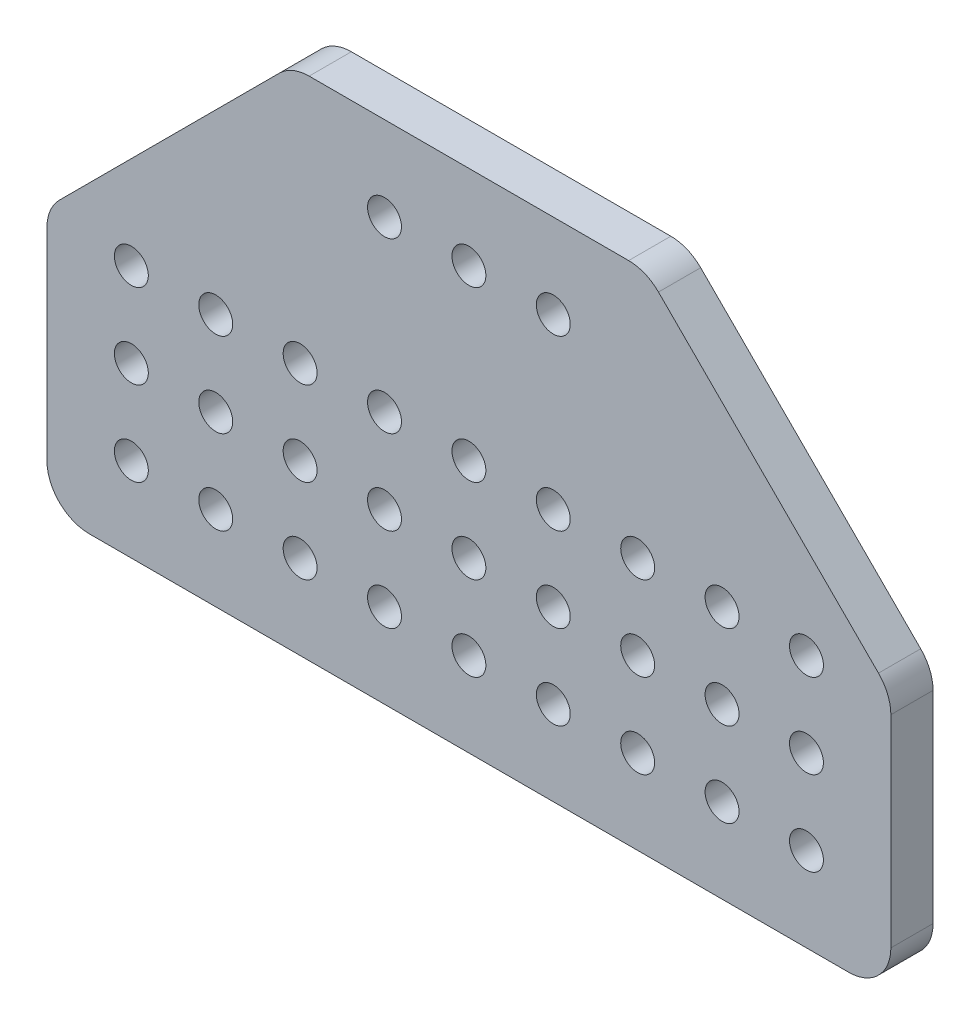
from build123d import *

# Parameters (mm, degrees)
SKETCH1_W               = 127
SKETCH1_H               = 82.55
BOSS_EXTRUDE1_DEPTH     = 6.35
CUT_EXTRUDE1_DEPTH      = 152.604172106
CUT_EXTRUDE1_DEPTH_BACK = 152.604172106
SKETCH2_R               = 2.5527
SKETCH3_R               = 2.5527
CUT_EXTRUDE2_DEPTH      = 152.604172106
CUT_EXTRUDE3_DEPTH      = 152.604172106
CUT_EXTRUDE4_DEPTH      = 152.604172106
FILLET1_R               = 6.35


with BuildPart() as part:
    # Sketch1 → Boss-Extrude1 (new body)
    with BuildSketch(Plane.XY):
        with Locations((63.5, 41.275)):
            Rectangle(SKETCH1_W, SKETCH1_H)
    extrude(amount=BOSS_EXTRUDE1_DEPTH)

    # Sketch2 → Cut-Extrude1 (cut, two sides: drawn at the far end of the back side and taken through both)
    with BuildSketch(Plane(origin=(0, 0, 0), x_dir=(-1, 0, 0), z_dir=(0, 0, -1)).offset(-CUT_EXTRUDE1_DEPTH_BACK)):
        with Locations((-76.2, 63.5)):
            Circle(SKETCH2_R)
        with Locations((-63.5, 63.5)):
            Circle(SKETCH2_R)
        with Locations((-50.8, 63.5)):
            Circle(SKETCH2_R)
    extrude(amount=CUT_EXTRUDE1_DEPTH + CUT_EXTRUDE1_DEPTH_BACK, mode=Mode.SUBTRACT)

    # Sketch3 → Cut-Extrude2 (cut, through all)
    with BuildSketch(Plane(origin=(0, 0, 0), x_dir=(-1, 0, 0), z_dir=(0, 0, -1))):
        with Locations((-114.3, 38.1)):
            Circle(SKETCH3_R)
        with Locations((-114.3, 25.4)):
            Circle(SKETCH3_R)
        with Locations((-114.3, 12.7)):
            Circle(SKETCH3_R)
        with Locations((-101.6, 38.1)):
            Circle(SKETCH3_R)
        with Locations((-101.6, 25.4)):
            Circle(SKETCH3_R)
        with Locations((-101.6, 12.7)):
            Circle(SKETCH3_R)
        with Locations((-88.9, 38.1)):
            Circle(SKETCH3_R)
        with Locations((-88.9, 25.4)):
            Circle(SKETCH3_R)
        with Locations((-88.9, 12.7)):
            Circle(SKETCH3_R)
        with Locations((-76.2, 38.1)):
            Circle(SKETCH3_R)
        with Locations((-76.2, 25.4)):
            Circle(SKETCH3_R)
        with Locations((-76.2, 12.7)):
            Circle(SKETCH3_R)
        with Locations((-63.5, 38.1)):
            Circle(SKETCH3_R)
        with Locations((-63.5, 25.4)):
            Circle(SKETCH3_R)
        with Locations((-63.5, 12.7)):
            Circle(SKETCH3_R)
        with Locations((-50.8, 38.1)):
            Circle(SKETCH3_R)
        with Locations((-50.8, 25.4)):
            Circle(SKETCH3_R)
        with Locations((-50.8, 12.7)):
            Circle(SKETCH3_R)
        with Locations((-38.1, 38.1)):
            Circle(SKETCH3_R)
        with Locations((-38.1, 25.4)):
            Circle(SKETCH3_R)
        with Locations((-38.1, 12.7)):
            Circle(SKETCH3_R)
        with Locations((-25.4, 38.1)):
            Circle(SKETCH3_R)
        with Locations((-25.4, 25.4)):
            Circle(SKETCH3_R)
        with Locations((-25.4, 12.7)):
            Circle(SKETCH3_R)
        with Locations((-12.7, 38.1)):
            Circle(SKETCH3_R)
        with Locations((-12.7, 25.4)):
            Circle(SKETCH3_R)
        with Locations((-12.7, 12.7)):
            Circle(SKETCH3_R)
    extrude(amount=-CUT_EXTRUDE2_DEPTH, mode=Mode.SUBTRACT)

    # Sketch4 → Cut-Extrude3 (cut, through all)
    with BuildSketch(Plane(origin=(0, 0, 0), x_dir=(-1, 0, 0), z_dir=(0, 0, -1))):
        Polygon((-83.82, 82.55), (-127, 39.37), (-127, 82.55), align=None)
        Polygon((-43.18, 82.55), (0, 82.55), (0, 39.37), align=None)
    extrude(amount=-CUT_EXTRUDE3_DEPTH, mode=Mode.SUBTRACT)

    # Sketch5 → Cut-Extrude4 (cut, through all)
    with BuildSketch(Plane(origin=(0, 0, 0), x_dir=(-1, 0, 0), z_dir=(0, 0, -1))):
        Polygon((-90.17, 76.2), (-36.83, 76.2), (-43.18, 82.55), (-83.82, 82.55), align=None)
    extrude(amount=-CUT_EXTRUDE4_DEPTH, mode=Mode.SUBTRACT)

    # Fillet1
    fillet1_edges = [part.edges().sort_by_distance(p)[0] for p in [
        (127, 39.37, 3.175),
        (127, 0, 3.175),
        (0, 0, 3.175),
        (36.83, 76.2, 3.175),
        (90.17, 76.2, 3.175),
        (0, 39.37, 3.175),
    ]]
    fillet(fillet1_edges, radius=FILLET1_R)


solid = part.part
